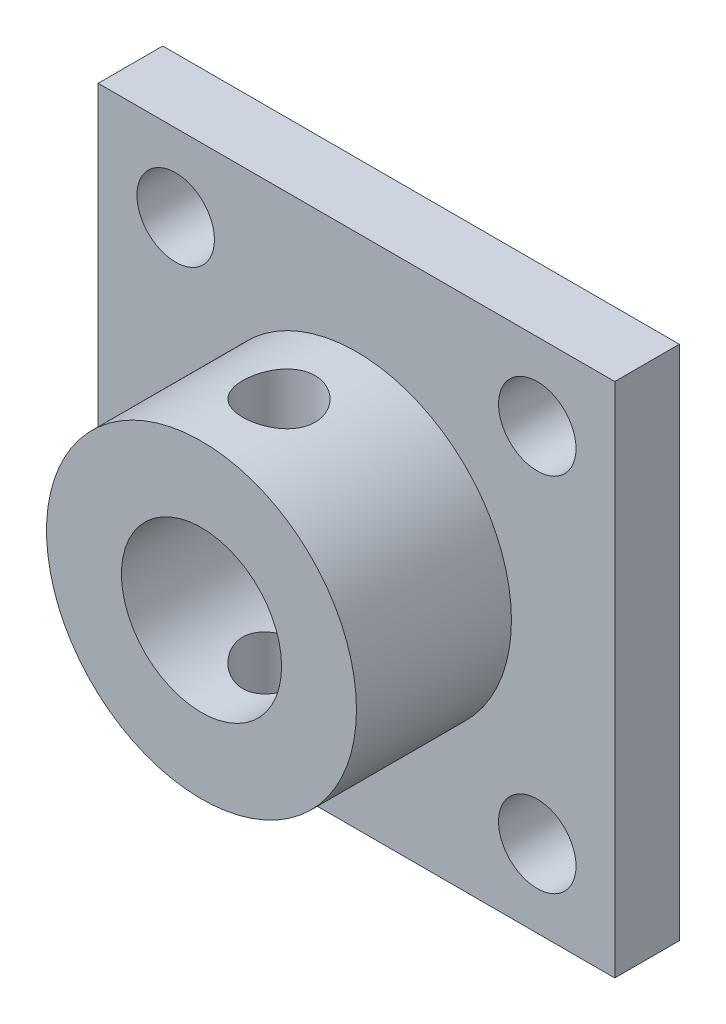
from build123d import *

# Parameters (mm, degrees)
SKETCH_1_W               = 20
SKETCH_1_H               = 20
SKETCH_1_R               = 1.5
SKETCH_1_R_2             = 3.1
EXTRUDE_1_DEPTH          = 2.5
SKETCH_2_R               = 6
SKETCH_2_R_2             = 3.1
EXTRUDE_2_DEPTH          = 6
CUT_EXTRUDE_1_DEPTH      = 17.5
CUT_EXTRUDE_1_DEPTH_BACK = 17.5
SKETCH_3_R               = 1.4


with BuildPart() as part:
    # 草图1 → 凸台-拉伸1 (new body)
    with BuildSketch(Plane.XY):
        Rectangle(SKETCH_1_W, SKETCH_1_H)
        with Locations((-7, 7)):
            Circle(SKETCH_1_R, mode=Mode.SUBTRACT)
        with Locations((7, 7)):
            Circle(SKETCH_1_R, mode=Mode.SUBTRACT)
        with Locations((7, -7)):
            Circle(SKETCH_1_R, mode=Mode.SUBTRACT)
        with Locations((-7, -7)):
            Circle(SKETCH_1_R, mode=Mode.SUBTRACT)
        Circle(SKETCH_1_R_2, mode=Mode.SUBTRACT)
    extrude(amount=EXTRUDE_1_DEPTH)

    # 草图2 → 凸台-拉伸2 (add)
    with BuildSketch(Plane.XY.offset(2.5)):
        Circle(SKETCH_2_R)
        Circle(SKETCH_2_R_2, mode=Mode.SUBTRACT)
    extrude(amount=EXTRUDE_2_DEPTH)

    # 草图3 → 切除-拉伸1 (cut, two sides: drawn at the far end of the back side and taken through both)
    with BuildSketch(Plane(origin=(0, 0, 0), x_dir=(1, 0, 0), z_dir=(0, 1, 0)).offset(-CUT_EXTRUDE_1_DEPTH_BACK)):
        with Locations((0, -5.5)):
            Circle(SKETCH_3_R)
    extrude(amount=CUT_EXTRUDE_1_DEPTH + CUT_EXTRUDE_1_DEPTH_BACK, mode=Mode.SUBTRACT)


solid = part.part
